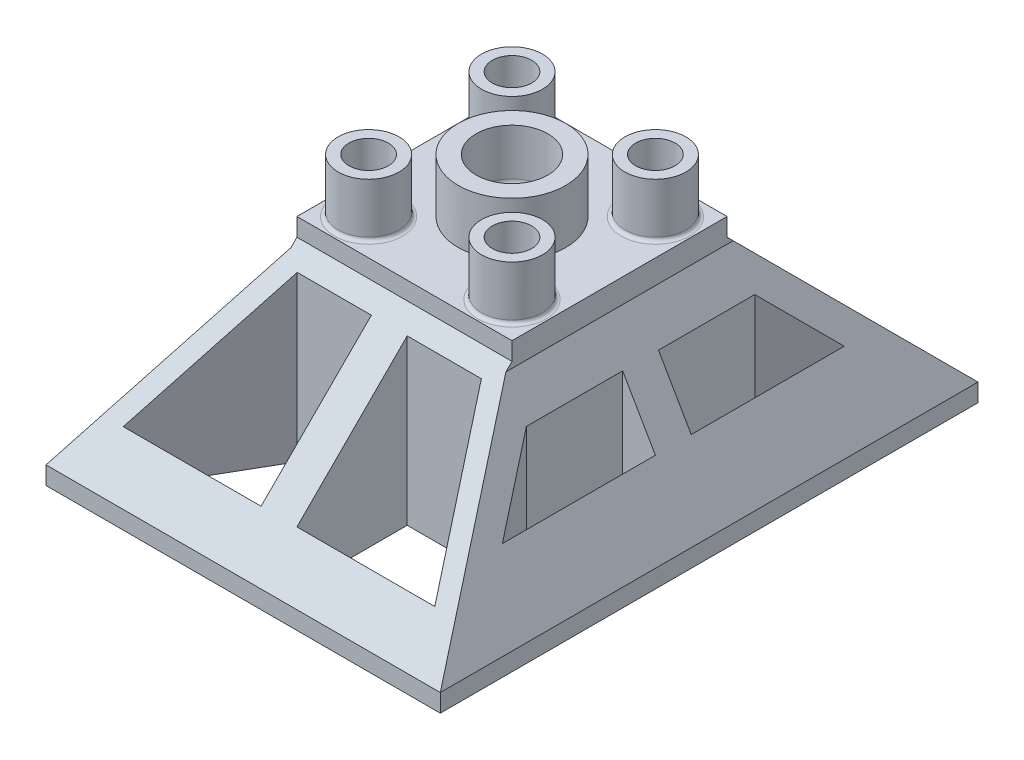
from build123d import *
from OCP.BRepFilletAPI import BRepFilletAPI_MakeChamfer

# Parameters (mm, degrees)
SKETCH_1_W               = 60
SKETCH_1_H               = 60
SKETCH_1_R               = 5.5
EXTRUDE_1_DEPTH          = 7
SKETCH_2_R               = 8.5
SKETCH_2_R_2             = 5.5
SKETCH_2_R_3             = 15
EXTRUDE_2_DEPTH          = 15
SKETCH_3_W               = 60
SKETCH_3_H               = 60
EXTRUDE_3_DEPTH          = 48
SKETCH_5_W               = 110
SKETCH_5_H               = 150
EXTRUDE_4_DEPTH          = 5
CUT_EXTRUDE_1_DEPTH      = 109.050913925
CUT_EXTRUDE_1_DEPTH_BACK = 109.050913925
SKETCH_4_R               = 10
FILLET_1_R               = 1
FILLET_4_R               = 10
EXTRUDE_START            = 55
SKETCH_6_R               = 10
SKETCH_6_R_2             = 7.5
EXTRUDE_5_DEPTH          = 5
FILLET_5_R               = 2
CHAMFER_1_SIZE           = 45
CHAMFER_2_SIZE           = 43.301270189
CHAMFER_2_SIZE_2         = 25
CUT_EXTRUDE_2_DEPTH      = 117.404467268


with BuildPart() as part:
    # 草圖1 → 填料-伸長1 (new body)
    with BuildSketch(Plane(origin=(0, 0, 0), x_dir=(1, 0, 0), z_dir=(0, 1, 0))):
        Rectangle(SKETCH_1_W, SKETCH_1_H)
        with Locations(Location((20, 20, 0), (0, 0, 270))):
            Circle(SKETCH_1_R, mode=Mode.SUBTRACT)
        with Locations(Location((-20, 20, 0), (0, 0, 90))):
            Circle(SKETCH_1_R, mode=Mode.SUBTRACT)
        with Locations(Location((20, -20, 0), (0, 0, 90))):
            Circle(SKETCH_1_R, mode=Mode.SUBTRACT)
        with Locations(Location((-20, -20, 0), (0, 0, 270))):
            Circle(SKETCH_1_R, mode=Mode.SUBTRACT)
    extrude(amount=EXTRUDE_1_DEPTH)

    # 草圖2 → 填料-伸長2 (add)
    # profile 1 of 5: a face of its own
    with BuildSketch(Plane(origin=(0, 7, 0), x_dir=(1, 0, 0), z_dir=(0, 1, 0))):
        with Locations(Location((-20, 20, 0), (0, 0, 90))):
            Circle(SKETCH_2_R)
        with Locations(Location((-20, 20, 0), (0, 0, 90))):
            Circle(SKETCH_2_R_2, mode=Mode.SUBTRACT)
    # profile 2 of 5: a face of its own
    with BuildSketch(Plane(origin=(0, 7, 0), x_dir=(1, 0, 0), z_dir=(0, 1, 0))):
        with Locations(Location((20, 20, 0), (0, 0, 90))):
            Circle(SKETCH_2_R)
        with Locations(Location((20, 20, 0), (0, 0, 270))):
            Circle(SKETCH_2_R_2, mode=Mode.SUBTRACT)
    # profile 3 of 5: a face of its own
    with BuildSketch(Plane(origin=(0, 7, 0), x_dir=(1, 0, 0), z_dir=(0, 1, 0))):
        with Locations(Location((20, -20, 0), (0, 0, 90))):
            Circle(SKETCH_2_R)
        with Locations(Location((20, -20, 0), (0, 0, 90))):
            Circle(SKETCH_2_R_2, mode=Mode.SUBTRACT)
    # profile 4 of 5: a face of its own
    with BuildSketch(Plane(origin=(0, 7, 0), x_dir=(1, 0, 0), z_dir=(0, 1, 0))):
        with Locations(Location((-20, -20, 0), (0, 0, 90))):
            Circle(SKETCH_2_R)
        with Locations(Location((-20, -20, 0), (0, 0, 270))):
            Circle(SKETCH_2_R_2, mode=Mode.SUBTRACT)
    # profile 5 of 5: a face of its own
    with BuildSketch(Plane(origin=(0, 7, 0), x_dir=(1, 0, 0), z_dir=(0, 1, 0))):
        with Locations(Location((0, 0, 0), (0, 0, 90))):
            Circle(SKETCH_2_R_3)
    extrude(amount=EXTRUDE_2_DEPTH)

    # 草圖3 → 填料-伸長3 (add)
    with BuildSketch(Plane.XZ):
        Rectangle(SKETCH_3_W, SKETCH_3_H)
    extrude(amount=EXTRUDE_3_DEPTH)

    # 草圖5 → 填料-伸長4 (add)
    with BuildSketch(Plane.XZ.offset(48)):
        Rectangle(SKETCH_5_W, SKETCH_5_H)
    extrude(amount=-EXTRUDE_4_DEPTH)

    # 草圖4 → 除料-伸長1 (cut, two sides: drawn at the far end of the back side and taken through both)
    with BuildSketch(Plane(origin=(0, 7, 0), x_dir=(1, 0, 0), z_dir=(0, 1, 0)).offset(-CUT_EXTRUDE_1_DEPTH_BACK)):
        with Locations(Location((0, 0, 0), (0, 0, 270))):
            Circle(SKETCH_4_R)
    extrude(amount=CUT_EXTRUDE_1_DEPTH + CUT_EXTRUDE_1_DEPTH_BACK, mode=Mode.SUBTRACT)

    # 圓角1
    fillet_1_edges = [part.edges().sort_by_distance(p)[0] for p in [
        (-20, 7, -11.5),
        (20, 7, -11.5),
        (20, 7, 28.5),
        (-20, 7, 28.5),
    ]]
    fillet(fillet_1_edges, radius=FILLET_1_R)

    # 圓角4
    fillet_4_edges = [part.edges().sort_by_distance(p)[0] for p in [
        (0, -48, -10),
    ]]
    fillet(fillet_4_edges, radius=FILLET_4_R)

    # 草圖6 → 填料-伸長5 (add)
    with BuildSketch(Plane(origin=(0, -48, 0), x_dir=(1, 0, 0), z_dir=(0, 1, 0)).offset(EXTRUDE_START)):
        with Locations(Location((0, 0, 0), (0, 0, 270))):
            Circle(SKETCH_6_R)
        with Locations(Location((0, 0, 0), (0, 0, 270))):
            Circle(SKETCH_6_R_2, mode=Mode.SUBTRACT)
    extrude(amount=-EXTRUDE_5_DEPTH)

    # 圓角5
    fillet_5_edges = [part.edges().sort_by_distance(p)[0] for p in [
        (0, 2, -10),
        (0, 7, -10),
    ]]
    fillet(fillet_5_edges, radius=FILLET_5_R)

    # 導角1
    chamfer_1_edges = [part.edges().sort_by_distance(p)[0] for p in [
        (0, -43, 30),
        (0, -43, -30),
    ]]
    chamfer(chamfer_1_edges, length=CHAMFER_1_SIZE - 0.0001)  # a hair under: the kernel refuses the full size

    # 導角2
    chamfer_2_edges_1 = [part.edges().sort_by_distance(p)[0] for p in [
        (30, -43, 0),
    ]]
    chamfer_2_side_1 = [part.faces().sort_by_distance(p)[0] for p in [
        (30, -42.5, 0),
    ]]
    chamfer_2_edges_2 = [part.edges().sort_by_distance(p)[0] for p in [
        (-30, -43, 0),
    ]]
    chamfer_2_side_2 = [part.faces().sort_by_distance(p)[0] for p in [
        (-30.5, -43, 0),
    ]]
    chamfer_2 = BRepFilletAPI_MakeChamfer(part.part.solid().wrapped)
    for e in chamfer_2_edges_1:
        chamfer_2.Add(CHAMFER_2_SIZE - 0.0001, CHAMFER_2_SIZE_2 - 0.0001, e.wrapped, chamfer_2_side_1[0].wrapped)
    for e in chamfer_2_edges_2:
        chamfer_2.Add(CHAMFER_2_SIZE_2 - 0.0001, CHAMFER_2_SIZE - 0.0001, e.wrapped, chamfer_2_side_2[0].wrapped)
    add(Compound.cast(chamfer_2.Shape()), mode=Mode.REPLACE)  # a hair under: the kernel refuses the full size

    # 草圖7 → 除料-伸長2 (cut, through all)
    with BuildSketch(Plane.XZ.offset(48)):
        Polygon((-43.452994616, -65), (-25.688134905, -34.230360391), (-5, -34.230360391), (-5, -65), align=None)
        Polygon((-45, -47.679491924), (-35.865863045, -31.858702635), (-35.865863045, -5), (-45, -5), align=None)
        Polygon((35.865863045, -5), (45, -5), (45, -47.679491924), (35.865863045, -31.858702635), align=None)
        Polygon((5, -34.230360391), (5, -65), (43.452994616, -65), (25.688134905, -34.230360391), align=None)
        Polygon((-35.865863045, 5), (-45, 5), (-45, 47.679491924), (-35.865863045, 31.858702635), align=None)
        Polygon((-5, 34.230360391), (-5, 65), (-43.452994616, 65), (-25.688134905, 34.230360391), align=None)
        Polygon((35.865863045, 31.858702635), (35.865863045, 5), (45, 5), (45, 47.679491924), align=None)
        Polygon((25.688134905, 34.230360391), (5, 34.230360391), (5, 65), (43.452994616, 65), align=None)
    extrude(amount=-CUT_EXTRUDE_2_DEPTH, mode=Mode.SUBTRACT)


solid = part.part
